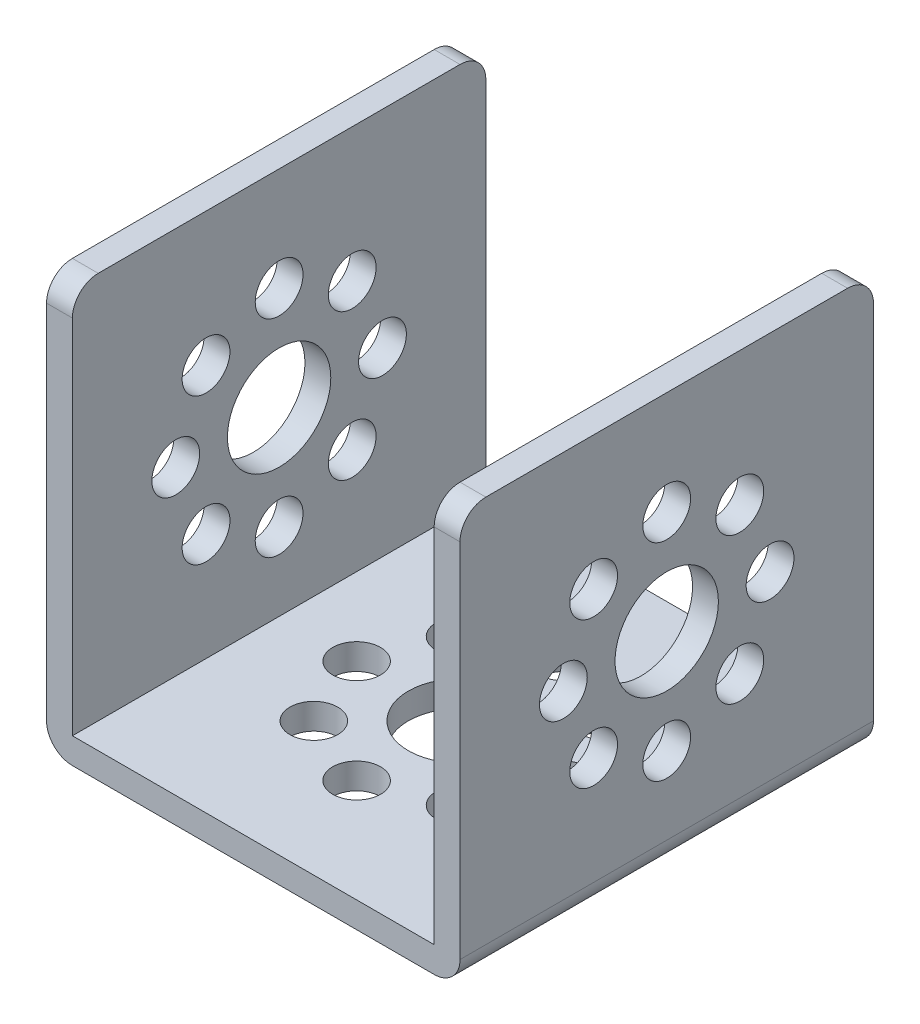
from build123d import *

# Parameters (mm, degrees)
BOSS_EXTRUDE1_DEPTH = 16
FILLET1_R           = 2
FILLET2_R           = 2
SKETCH5_R           = 4
SKETCH5_R_2         = 1.85
CUT_EXTRUDE1_DEPTH  = 32
SKETCH8_R           = 4
SKETCH8_R_2         = 1.85
CUT_EXTRUDE2_DEPTH  = 2


with BuildPart() as part:
    # Sketch3 → Boss-Extrude1 (new, symmetric)
    with BuildSketch(Plane.XY):
        with BuildLine():
            Line((-14, 0), (14, 0))
            ThreePointArc((14, 0), (15.414213562, 0.585786438), (16, 2))
            Line((16, 2), (16, 32))
            Line((16, 32), (14, 32))
            Line((14, 32), (14, 2))
            Line((14, 2), (-14, 2))
            Line((-14, 2), (-14, 32))
            Line((-14, 32), (-16, 32))
            Line((-16, 32), (-16, 2))
            ThreePointArc((-16, 2), (-15.414213562, 0.585786438), (-14, 0))
        make_face()
    extrude(amount=BOSS_EXTRUDE1_DEPTH, both=True)

    # Fillet1
    fillet1_edges = [part.edges().sort_by_distance(p)[0] for p in [
        (15, 32, 16),
        (15, 32, -16),
    ]]
    fillet(fillet1_edges, radius=FILLET1_R)

    # Fillet2
    fillet2_edges = [part.edges().sort_by_distance(p)[0] for p in [
        (-15, 32, -16),
        (-15, 32, 16),
    ]]
    fillet(fillet2_edges, radius=FILLET2_R)

    # Sketch5 → Cut-Extrude1 (cut)
    with BuildSketch(Plane(origin=(16, 0, 0), x_dir=(0, 0, -1), z_dir=(1, 0, 0))):
        with Locations((0, 16)):
            Circle(SKETCH5_R)
        with Locations((0, 8)):
            Circle(SKETCH5_R_2)
        with Locations((0, 24)):
            Circle(SKETCH5_R_2)
        with Locations((-8, 16)):
            Circle(SKETCH5_R_2)
        with Locations((8, 16)):
            Circle(SKETCH5_R_2)
        with Locations((5.656854249, 21.656854249)):
            Circle(SKETCH5_R_2)
        with Locations((-5.656854249, 21.656854249)):
            Circle(SKETCH5_R_2)
        with Locations((5.656854249, 10.343145751)):
            Circle(SKETCH5_R_2)
        with Locations((-5.656854249, 10.343145751)):
            Circle(SKETCH5_R_2)
    extrude(amount=-CUT_EXTRUDE1_DEPTH, mode=Mode.SUBTRACT)

    # Sketch8 → Cut-Extrude2 (cut)
    with BuildSketch(Plane(origin=(0, 2, 0), x_dir=(1, 0, 0), z_dir=(0, 1, 0))):
        Circle(SKETCH8_R)
        with Locations((0, -8)):
            Circle(SKETCH8_R_2)
        with Locations((0, 8)):
            Circle(SKETCH8_R_2)
        with Locations((-8, 0)):
            Circle(SKETCH8_R_2)
        with Locations((8, 0)):
            Circle(SKETCH8_R_2)
        with Locations((5.656854249, 5.656854249)):
            Circle(SKETCH8_R_2)
        with Locations((-5.656854249, 5.656854249)):
            Circle(SKETCH8_R_2)
        with Locations((5.656854249, -5.656854249)):
            Circle(SKETCH8_R_2)
        with Locations((-5.656854249, -5.656854249)):
            Circle(SKETCH8_R_2)
    extrude(amount=-CUT_EXTRUDE2_DEPTH, mode=Mode.SUBTRACT)


solid = part.part
